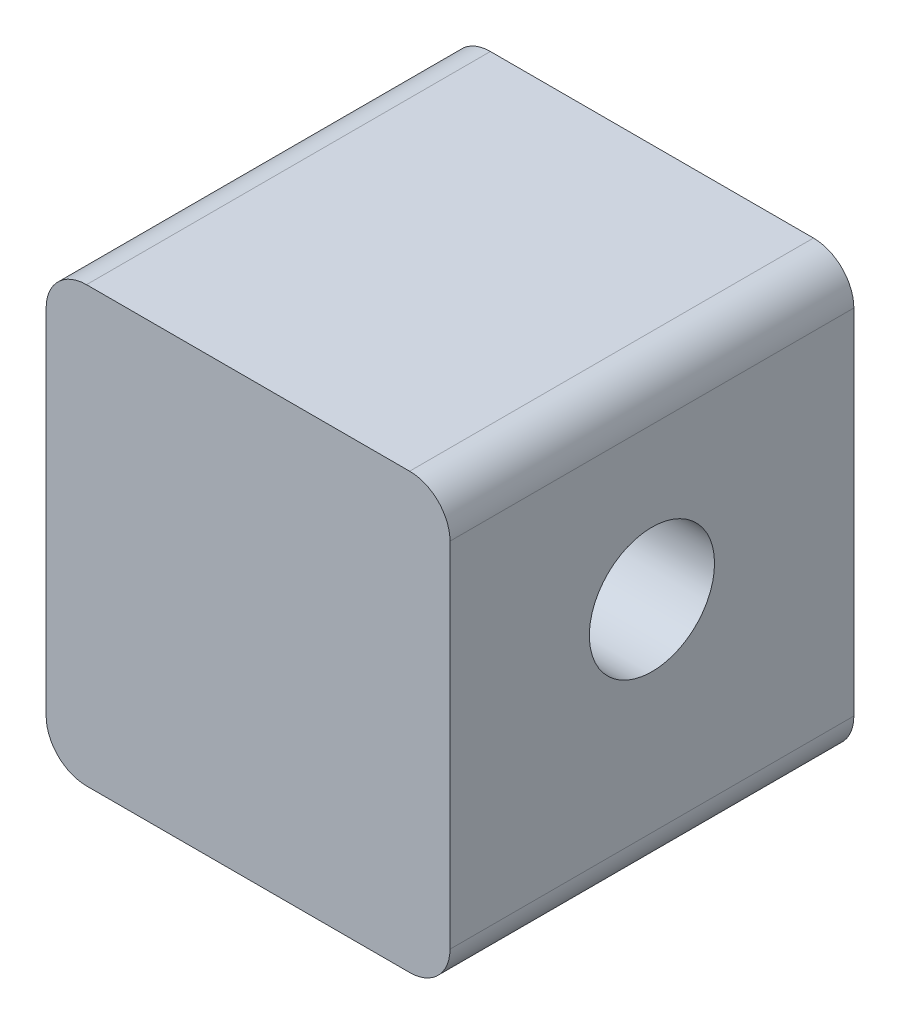
from build123d import *

# Parameters (mm, degrees)
BOSS_EXTRUDE1_DEPTH     = 10
CUT_EXTRUDE1_DEPTH      = 26.734218465
CUT_EXTRUDE1_DEPTH_BACK = 26.734218465
SKETCH2_R               = 3.1
SKETCH3_R               = 2
CUT_EXTRUDE2_DEPTH      = 8.5


with BuildPart() as part:
    # Sketch1 → Boss-Extrude1 (new, symmetric)
    with BuildSketch(Plane.XY):
        with BuildLine():
            Line((-8, -21.5), (8, -21.5))
            ThreePointArc((8, -21.5), (9.414213562, -20.914213562), (10, -19.5))
            Line((10, -19.5), (10, -2))
            ThreePointArc((10, -2), (9.414213562, -0.585786438), (8, 0))
            Line((8, 0), (-8, 0))
            ThreePointArc((-8, 0), (-9.414213562, -0.585786438), (-10, -2))
            Line((-10, -2), (-10, -19.5))
            ThreePointArc((-10, -19.5), (-9.414213562, -20.914213562), (-8, -21.5))
        make_face()
    extrude(amount=BOSS_EXTRUDE1_DEPTH, both=True)

    # Sketch2 → Cut-Extrude1 (cut, two sides: drawn at the far end of the back side and taken through both)
    with BuildSketch(Plane(origin=(0, 0, 0), x_dir=(0, 0, -1), z_dir=(1, 0, 0)).offset(-CUT_EXTRUDE1_DEPTH_BACK)):
        with Locations((0, -9.5)):
            Circle(SKETCH2_R)
    extrude(amount=CUT_EXTRUDE1_DEPTH + CUT_EXTRUDE1_DEPTH_BACK, mode=Mode.SUBTRACT)

    # Sketch3 → Cut-Extrude2 (cut)
    with BuildSketch(Plane(origin=(0, -21.5, 0), x_dir=(1, 0, 0), z_dir=(0, 1, 0))):
        Circle(SKETCH3_R)
    extrude(amount=CUT_EXTRUDE2_DEPTH, mode=Mode.SUBTRACT)


solid = part.part
